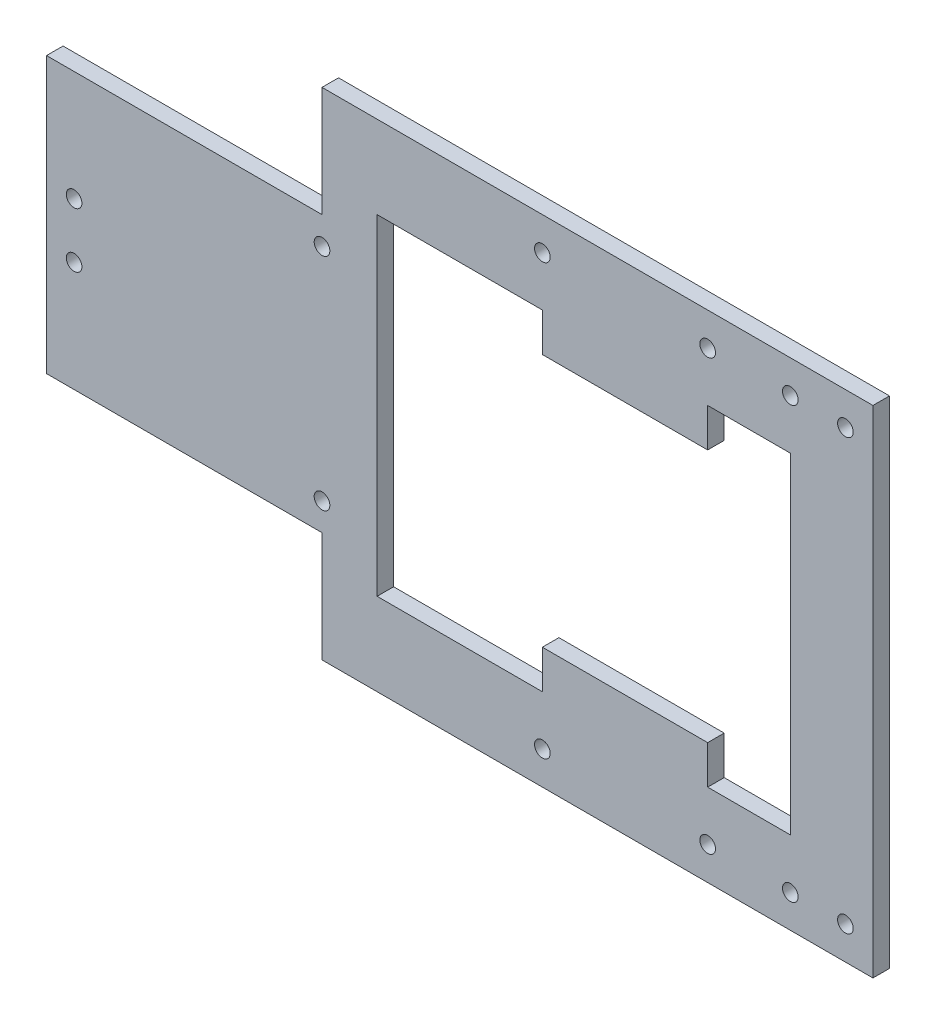
from build123d import *

# Parameters (mm, degrees)
SKETCH1_R           = 1.42
BOSS_EXTRUDE1_DEPTH = 3


with BuildPart() as part:
    # Sketch1 → Boss-Extrude1 (new body)
    with BuildSketch(Plane.XY):
        Polygon((-55, 45), (45, 45), (45, -45), (-55, -45), (-55, -25), (-105, -25), (-105, 25), (-55, 25), align=None)
        with Locations((15, 39)):
            Circle(SKETCH1_R, mode=Mode.SUBTRACT)
        with Locations((-15, 39)):
            Circle(SKETCH1_R, mode=Mode.SUBTRACT)
        with Locations((-15, -39)):
            Circle(SKETCH1_R, mode=Mode.SUBTRACT)
        with Locations((15, -39)):
            Circle(SKETCH1_R, mode=Mode.SUBTRACT)
        with Locations((30.000092503, 39.056338633)):
            Circle(SKETCH1_R, mode=Mode.SUBTRACT)
        with Locations((40, 39.013326424)):
            Circle(SKETCH1_R, mode=Mode.SUBTRACT)
        with Locations((-55, 20)):
            Circle(SKETCH1_R, mode=Mode.SUBTRACT)
        with Locations((-55, -20)):
            Circle(SKETCH1_R, mode=Mode.SUBTRACT)
        with Locations((40, -39.013326424)):
            Circle(SKETCH1_R, mode=Mode.SUBTRACT)
        with Locations((30.000092503, -39.056338633)):
            Circle(SKETCH1_R, mode=Mode.SUBTRACT)
        with Locations((-100, 5)):
            Circle(SKETCH1_R, mode=Mode.SUBTRACT)
        with Locations((-100, -5)):
            Circle(SKETCH1_R, mode=Mode.SUBTRACT)
        Polygon((-15, 30), (-45, 30), (-45, -30), (-15, -30), (-15, -23), (15, -23), (15, -30), (30.000092503, -30), (30.000092503, 30), (15, 30), (15, 23), (-15, 23), align=None, mode=Mode.SUBTRACT)
    extrude(amount=BOSS_EXTRUDE1_DEPTH)


solid = part.part
